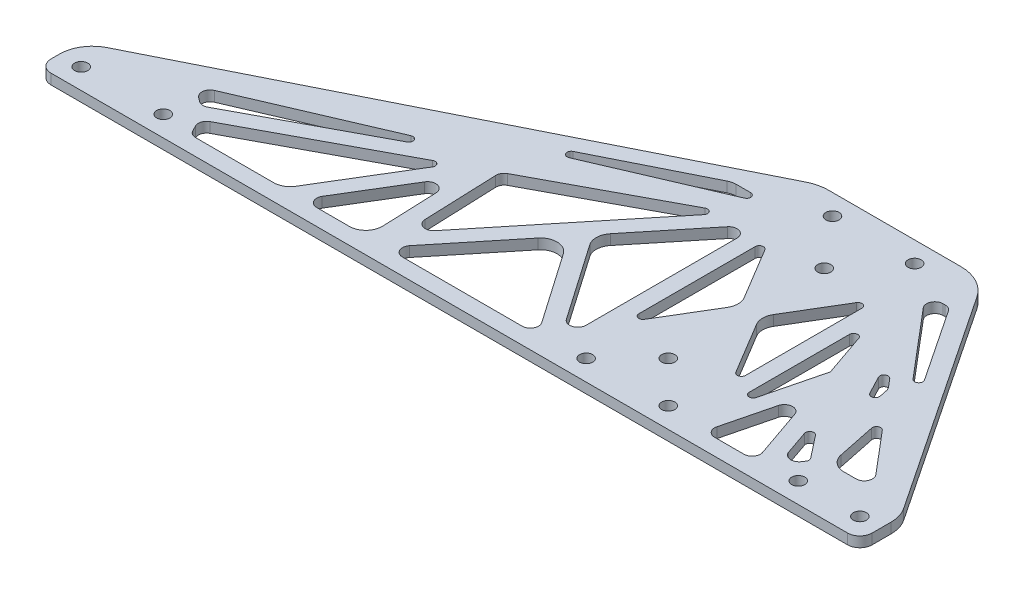
from build123d import *

# Parameters (mm, degrees)
SKETCH1_R           = 2.032
BOSS_EXTRUDE1_DEPTH = 3.175
SKETCH1_3_R         = 2.032
CUT_EXTRUDE2_DEPTH  = 270.126904313
FILLET1_R           = 3.81
FILLET2_R           = 10.16
FILLET3_R           = 12.7
FILLET4_R           = 1.27
FILLET5_R           = 2.54
FILLET6_R           = 5.08


with BuildPart() as part:
    # Sketch1 → Boss-Extrude1 (new body)
    with BuildSketch(Plane(origin=(0, 0, 0), x_dir=(1, 0, 0), z_dir=(0, 1, 0))):
        Polygon((0, 0), (254, 0), (254, 12.7), (203.2, 88.9), (152.4, 88.9), (0, 12.7), align=None)
        with Locations((6.773333333, 6.35)):
            Circle(SKETCH1_R, mode=Mode.SUBTRACT)
        with Locations((32.173333333, 6.35)):
            Circle(SKETCH1_R, mode=Mode.SUBTRACT)
        with Locations((228.6, 6.35)):
            Circle(SKETCH1_R, mode=Mode.SUBTRACT)
        with Locations((247.65, 6.35)):
            Circle(SKETCH1_R, mode=Mode.SUBTRACT)
        with Locations((162.983333333, 82.55)):
            Circle(SKETCH1_R, mode=Mode.SUBTRACT)
        with Locations((188.383333333, 82.55)):
            Circle(SKETCH1_R, mode=Mode.SUBTRACT)
    extrude(amount=BOSS_EXTRUDE1_DEPTH)

    # Sketch1<3> → Cut-Extrude2 (cut, through all)
    with BuildSketch(Plane(origin=(0, 0, 0), x_dir=(1, 0, 0), z_dir=(0, 1, 0))):
        Polygon((39.160127309, 10.433958769), (41.874510307, 5.08), (70.459110655, 5.08), (90.331883407, 37.826895453), align=None)
        Polygon((76.401361816, 5.08), (96.288373818, 5.08), (95.107733837, 35.904868603), align=None)
        Polygon((127.570752901, 36.414671497), (102.103358932, 5.08), (149.298298116, 5.08), align=None)
        Polygon((150.195302167, 76.2), (138.359225326, 76.2), (66.419120067, 40.229947371), align=None)
        Polygon((29.646805141, 18.912972806), (35.757110623, 14.374351834), (103.353340378, 50.559532546), align=None)
        Polygon((154.093333333, 69.047627429), (130.906568677, 40.519005519), (154.093333333, 7.079901082), align=None)
        Polygon((146.694432915, 67.998534414), (99.921228518, 42.960202251), (101.110396846, 11.912670369), align=None)
        with Locations((162.983333333, 6.35)):
            Circle(SKETCH1_3_R)
        Polygon((233.45048443, 34.366173115), (205.561266507, 76.2), (198.060312203, 76.2), align=None)
        Polygon((207.411621605, 31.741918623), (200.727780974, 5.08), (216.626583121, 5.08), align=None)
        with Locations((188.383333333, 6.35)):
            Circle(SKETCH1_3_R)
        Polygon((214.360813589, 27.186853093), (221.088734871, 7.720760975), (225.03662739, 13.595166828), align=None)
        Polygon((197.273333333, 61.075325647), (197.273333333, 12.191395039), (204.376138918, 40.524569775), align=None)
        Polygon((172.721209771, 44.45), (159.173333333, 67.029794062), (159.173333333, 21.870205938), align=None)
        Polygon((229.119714982, 15.811166321), (242.49351009, 15.811166321), (224.788319061, 36.740024529), align=None)
        Polygon((217.920532914, 44.858260713), (207.815682967, 56.802948088), (220.392582257, 32.913573338), align=None)
        Polygon((192.193333333, 67.029794062), (178.645456896, 44.45), (192.193333333, 21.870205938), align=None)
        with Locations((175.683333333, 19.05)):
            Circle(SKETCH1_3_R)
        with Locations((175.683333333, 67.31)):
            Circle(SKETCH1_3_R)
    extrude(amount=CUT_EXTRUDE2_DEPTH, mode=Mode.SUBTRACT)

    # Fillet1
    fillet1_edges = [part.edges().sort_by_distance(p)[0] for p in [
        (254, 1.5875, 0),
        (0, 1.5875, 0),
    ]]
    fillet(fillet1_edges, radius=FILLET1_R)

    # Fillet2
    fillet2_edges = [part.edges().sort_by_distance(p)[0] for p in [
        (254, 1.5875, -12.7),
        (0, 1.5875, -12.7),
    ]]
    fillet(fillet2_edges, radius=FILLET2_R)

    # Fillet3
    fillet3_edges = [part.edges().sort_by_distance(p)[0] for p in [
        (203.2, 1.5875, -88.9),
        (152.4, 1.5875, -88.9),
    ]]
    fillet(fillet3_edges, radius=FILLET3_R)

    # Fillet4
    fillet4_edges = [part.edges().sort_by_distance(p)[0] for p in [
        (214.360813589, 1.5875, -27.186853093),
        (233.45048443, 1.5875, -34.366173115),
        (207.815682967, 1.5875, -56.802948088),
        (220.392582257, 1.5875, -32.913573338),
        (197.273333333, 1.5875, -61.075325647),
        (197.273333333, 1.5875, -12.191395039),
        (159.173333333, 1.5875, -67.029794062),
        (192.193333333, 1.5875, -67.029794062),
        (192.193333333, 1.5875, -21.870205938),
        (159.173333333, 1.5875, -21.870205938),
        (146.694432915, 1.5875, -67.998534414),
        (66.419120067, 1.5875, -40.229947371),
        (150.195302167, 1.5875, -76.2),
        (224.788319061, 1.5875, -36.740024529),
        (103.353340378, 1.5875, -50.559532546),
        (90.331883407, 1.5875, -37.826895453),
        (225.03662739, 1.5875, -13.595166828),
    ]]
    fillet(fillet4_edges, radius=FILLET4_R)

    # Fillet5
    fillet5_edges = [part.edges().sort_by_distance(p)[0] for p in [
        (39.160127309, 1.5875, -10.433958769),
        (41.874510307, 1.5875, -5.08),
        (99.921228518, 1.5875, -42.960202251),
        (101.110396846, 1.5875, -11.912670369),
        (95.107733837, 1.5875, -35.904868603),
        (76.401361816, 1.5875, -5.08),
        (35.757110623, 1.5875, -14.374351834),
        (29.646805141, 1.5875, -18.912972806),
        (198.060312203, 1.5875, -76.2),
        (205.561266507, 1.5875, -76.2),
        (217.920532914, 1.5875, -44.858260713),
        (242.49351009, 1.5875, -15.811166321),
        (221.088734871, 1.5875, -7.720760975),
        (216.626583121, 1.5875, -5.08),
        (200.727780974, 1.5875, -5.08),
        (207.411621605, 1.5875, -31.741918623),
        (154.093333333, 1.5875, -69.047627429),
        (149.298298116, 1.5875, -5.08),
        (102.103358932, 1.5875, -5.08),
        (154.093333333, 1.5875, -7.079901082),
    ]]
    fillet(fillet5_edges, radius=FILLET5_R)

    # Fillet6
    fillet6_edges = [part.edges().sort_by_distance(p)[0] for p in [
        (229.119714982, 1.5875, -15.811166321),
        (96.288373818, 1.5875, -5.08),
        (172.721209771, 1.5875, -44.45),
        (178.645456896, 1.5875, -44.45),
        (130.906568677, 1.5875, -40.519005519),
        (127.570752901, 1.5875, -36.414671497),
        (138.359225326, 1.5875, -76.2),
        (70.459110655, 1.5875, -5.08),
    ]]
    fillet(fillet6_edges, radius=FILLET6_R)


solid = part.part
